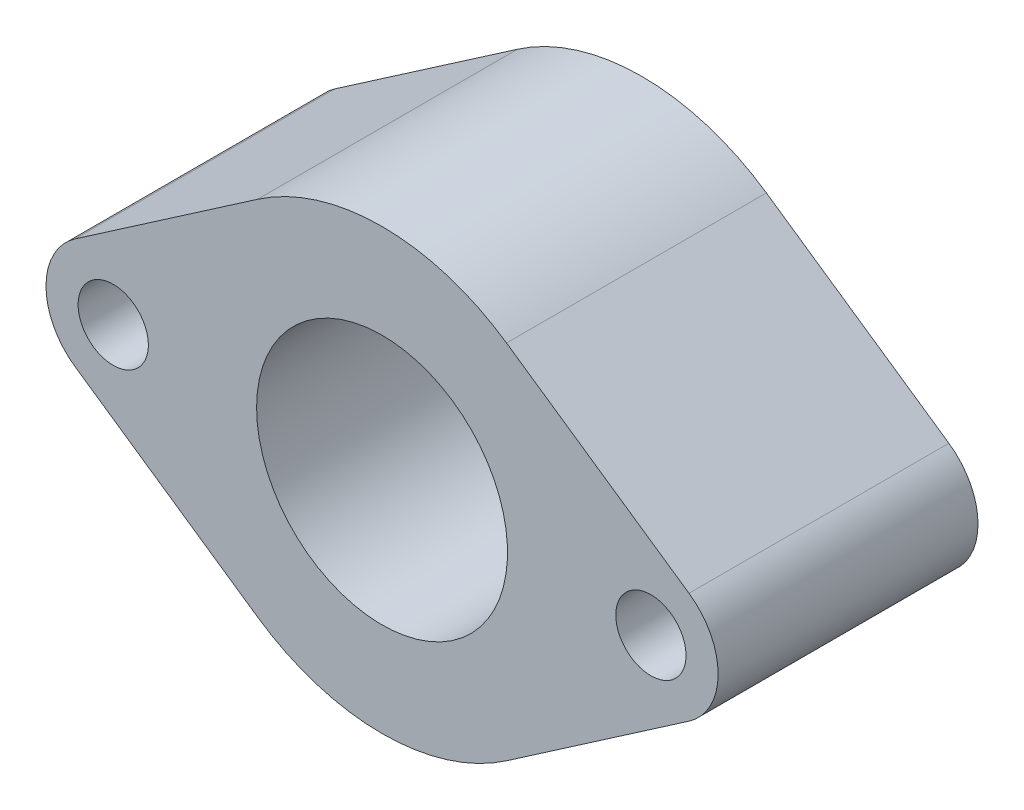
from build123d import *
from build123d.topology import SkipClean

# Parameters (mm, degrees)
SKETCH1_R           = 2.4892
SKETCH1_R_2         = 8.89
BOSS_EXTRUDE1_DEPTH = 15.24
BOSS_EXTRUDE2_START = 3.175
SKETCH3_R           = 2.4892
BOSS_EXTRUDE2_DEPTH = 3.175


with BuildPart() as part:
    # Sketch1 → Boss-Extrude1 (new body)
    with BuildSketch(Plane.XY):
        with BuildLine():
            Line((-21.749385, 3.923611458), (-8.819430672, 12.819223355))
            ThreePointArc((-8.819430672, 12.819223355), (0, 15.56004), (8.819430672, 12.819223355))
            Line((8.819430672, 12.819223355), (21.749385, 3.923611458))
            ThreePointArc((21.749385, 3.923611458), (23.8125, 0), (21.749385, -3.923611458))
            Line((21.749385, -3.923611458), (8.819430672, -12.819223355))
            ThreePointArc((8.819430672, -12.819223355), (0, -15.56004), (-8.819430672, -12.819223355))
            Line((-8.819430672, -12.819223355), (-21.749385, -3.923611458))
            ThreePointArc((-21.749385, -3.923611458), (-23.8125, 0), (-21.749385, 3.923611458))
        make_face()
        with Locations((-19.05, 0)):
            Circle(SKETCH1_R, mode=Mode.SUBTRACT)
        with Locations((19.05, 0)):
            Circle(SKETCH1_R, mode=Mode.SUBTRACT)
        Circle(SKETCH1_R_2, mode=Mode.SUBTRACT)
    extrude(amount=BOSS_EXTRUDE1_DEPTH)

    # Sketch3 → Boss-Extrude2 (add)
    with SkipClean():  # the faces are left unmerged after this step: merging them gives an invalid solid
        with BuildSketch(Plane(origin=(0, 0, 0), x_dir=(-1, 0, 0), z_dir=(0, 0, -1)).offset(BOSS_EXTRUDE2_START)):
            with BuildLine():
                Line((-8.819430672, -12.819223355), (-21.749385, -3.923611458))
                ThreePointArc((-21.749385, -3.923611458), (-23.8125, 0), (-21.749385, 3.923611458))
                Line((-21.749385, 3.923611458), (-8.819430672, 12.819223355))
                ThreePointArc((-8.819430672, 12.819223355), (0, 15.56004), (8.819430672, 12.819223355))
                Line((8.819430672, 12.819223355), (21.749385, 3.923611458))
                ThreePointArc((21.749385, 3.923611458), (23.8125, 0), (21.749385, -3.923611458))
                Line((21.749385, -3.923611458), (8.819430672, -12.819223355))
                ThreePointArc((8.819430672, -12.819223355), (0, -15.56004), (-8.819430672, -12.819223355))
            make_face()
            with Locations((-19.05, 0)):
                Circle(SKETCH3_R, mode=Mode.SUBTRACT)
            with Locations((19.05, 0)):
                Circle(SKETCH3_R, mode=Mode.SUBTRACT)
            with BuildLine():
                Line((-3.268434357, -0.469617778), (-2.463896669, -6.069019556))
                ThreePointArc((-2.463896669, -6.069019556), (0, -8.2042), (2.463896669, -6.069019556))
                Line((2.463896669, -6.069019556), (3.268434357, -0.469617778))
                ThreePointArc((3.268434357, -0.469617778), (0, 3.302), (-3.268434357, -0.469617778))
            make_face(mode=Mode.SUBTRACT)
        extrude(amount=-BOSS_EXTRUDE2_DEPTH)


solid = part.part
